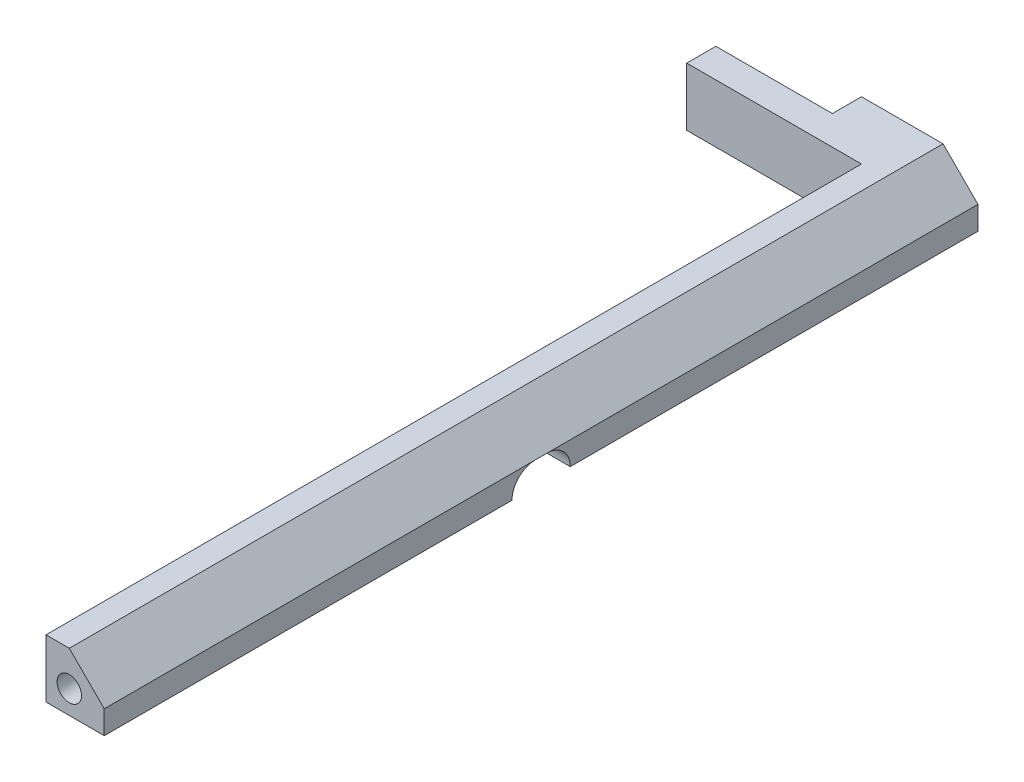
from build123d import *

# Parameters (mm, degrees)
DODANIE_WYCI_GNI_CIE1_DEPTH = 10
SZKIC2_R                    = 2.1
WYTNIJ_WYCI_GNI_CIE1_DEPTH  = 4
SZKIC3_R                    = 2.1
WYTNIJ_WYCI_GNI_CIE2_DEPTH  = 4
SFAZOWANIE1_SIZE            = 6
SZKIC4_W                    = 10
SZKIC4_H                    = 10
WYTNIJ_WYCI_GNI_CIE3_DEPTH  = 4
ZAOKR_GLENIE1_R             = 4


with BuildPart() as part:
    # Szkic1 → Dodanie-wyciągnięcie1 (new body)
    with BuildSketch(Plane(origin=(0, 0, 0), x_dir=(1, 0, 0), z_dir=(0, 1, 0))):
        Polygon((0, 0), (0, 150), (-20, 150), (-20, 145), (-40, 145), (-40, 140), (-10, 140), (-10, 0), align=None)
    extrude(amount=DODANIE_WYCI_GNI_CIE1_DEPTH)

    # Szkic2 → Wytnij-wyciągnięcie1 (cut)
    with BuildSketch(Plane.XZ):
        with Locations(Location((-7.2, -123, 0), (0, 0, 270))):
            Circle(SZKIC2_R)
        with Locations(Location((-7.2, -27, 0), (0, 0, 270))):
            Circle(SZKIC2_R)
    extrude(amount=-WYTNIJ_WYCI_GNI_CIE1_DEPTH, mode=Mode.SUBTRACT)

    # Szkic3 → Wytnij-wyciągnięcie2 (cut)
    with BuildSketch(Plane.XY):
        with Locations((-6, 4)):
            Circle(SZKIC3_R)
    extrude(amount=-WYTNIJ_WYCI_GNI_CIE2_DEPTH, mode=Mode.SUBTRACT)

    # Sfazowanie1
    sfazowanie1_edges = [part.edges().sort_by_distance(p)[0] for p in [
        (0, 10, -75),
    ]]
    chamfer(sfazowanie1_edges, length=SFAZOWANIE1_SIZE)

    # Szkic4 → Wytnij-wyciągnięcie3 (cut)
    with BuildSketch(Plane.XZ):
        with Locations((-5, -75)):
            Rectangle(SZKIC4_W, SZKIC4_H)
    extrude(amount=-WYTNIJ_WYCI_GNI_CIE3_DEPTH, mode=Mode.SUBTRACT)

    # Zaokrąglenie1
    zaokr_glenie1_edges = [part.edges().sort_by_distance(p)[0] for p in [
        (-5, 4, -80),
        (-5, 4, -70),
    ]]
    fillet(zaokr_glenie1_edges, radius=ZAOKR_GLENIE1_R - 0.0001)  # a hair under: the kernel refuses the full size


solid = part.part
